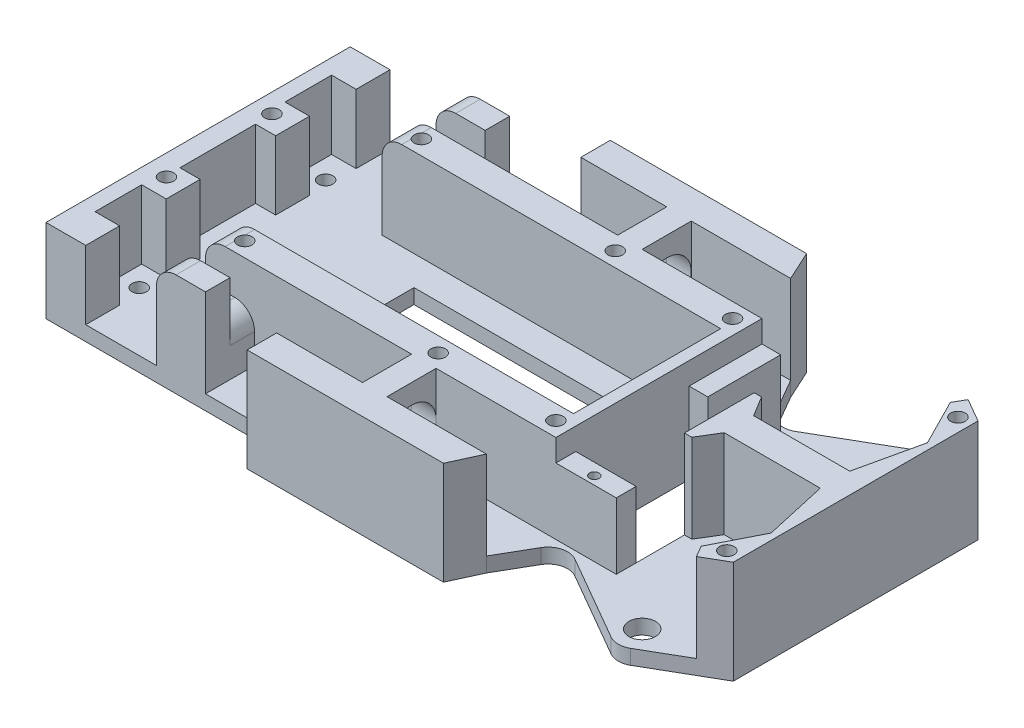
from build123d import *

# Parameters (mm, degrees)
SKETCH_1_W               = 134
SKETCH_1_H               = 62
EXTRUDE_1_DEPTH          = 3
SKETCH_2_R               = 2.7
CUT_EXTRUDE_1_DEPTH      = 4
EXTRUDE_3_DEPTH          = 3
CUT_EXTRUDE_4_DEPTH      = 4
CUT_EXTRUDE_4_DEPTH_BACK = 3
SKETCH_1_6_W             = 12.3
SKETCH_1_6_H             = 23.1
SKETCH_3_W               = 4
SKETCH_3_H               = 15.4
EXTRUDE_4_DEPTH          = 14
SKETCH_4_W               = 5
SKETCH_4_H               = 5
EXTRUDE_5_DEPTH          = 18
FILLET_1_R               = 4
EXTRUDE_6_DEPTH          = 18
SKETCH_6_W               = 12.3
SKETCH_6_H               = 4.05
SKETCH_6_W_2             = 3.8
SKETCH_6_H_2             = 14.85
EXTRUDE_7_DEPTH          = 13.5
SKETCH_7_R               = 1.48
CUT_EXTRUDE_5_DEPTH      = 5
EXTRUDE_9_DEPTH          = 18
EXTRUDE_10_DEPTH         = 18
EXTRUDE_START            = -21
SKETCH_11_W              = 5
SKETCH_11_H              = 10
EXTRUDE_11_DEPTH         = 21
SKETCH_12_R              = 5
CUT_EXTRUDE_6_DEPTH      = 6
SKETCH_13_R              = 5
CUT_EXTRUDE_7_DEPTH      = 6
SKETCH_14_R              = 0.965
CUT_EXTRUDE_8_DEPTH      = 10
SKETCH_17_R              = 1.48
CUT_EXTRUDE_10_DEPTH     = 30
SKETCH_18_R              = 1.48
CUT_EXTRUDE_11_DEPTH     = 30
SKETCH_19_R              = 1.48
CUT_EXTRUDE_12_DEPTH     = 30
SKETCH_20_W              = 5
SKETCH_20_H              = 5
CUT_EXTRUDE_13_DEPTH     = 8
SKETCH_21_R              = 1.48
CUT_EXTRUDE_14_DEPTH     = 30
SKETCH_22_R              = 1.48
CUT_EXTRUDE_15_DEPTH     = 30
SKETCH_23_R              = 1.48
CUT_EXTRUDE_16_DEPTH     = 30
SKETCH_24_W              = 50
SKETCH_24_H              = 18
CUT_EXTRUDE_17_DEPTH     = 30
FILLET_2_R               = 4
FILLET_3_R               = 4


with BuildPart() as part:
    # 草图1 → 凸台-拉伸1 (new body)
    with BuildSketch(Plane(origin=(0, 0, 0), x_dir=(1, 0, 0), z_dir=(0, 1, 0))):
        Rectangle(SKETCH_1_W, SKETCH_1_H)
    extrude(amount=EXTRUDE_1_DEPTH)

    # 草图2 → 切除-拉伸1 (cut)
    with BuildSketch(Plane(origin=(0, 3, 0), x_dir=(1, 0, 0), z_dir=(0, 1, 0))):
        with Locations(Location((51.5, 28, 0), (0, 0, 270))):
            Circle(SKETCH_2_R)
        with Locations(Location((51.5, -28, 0), (0, 0, 270))):
            Circle(SKETCH_2_R)
    extrude(amount=-CUT_EXTRUDE_1_DEPTH, mode=Mode.SUBTRACT)

    # 草图1<4> → 凸台-拉伸3 (add)
    with BuildSketch(Plane(origin=(0, 0, 0), x_dir=(1, 0, 0), z_dir=(0, 1, 0))):
        Polygon((51.75, 33.742413779), (47, 31), (56.5, 31), align=None)
        Polygon((56.5, -31), (47, -31), (51.75, -33.742413779), align=None)
    extrude(amount=EXTRUDE_3_DEPTH)

    # 草图1<6> → 切除-拉伸4 (cut, two sides: drawn at the far end of the back side and taken through both)
    with BuildSketch(Plane(origin=(0, 0, 0), x_dir=(1, 0, 0), z_dir=(0, 1, 0)).offset(-CUT_EXTRUDE_4_DEPTH_BACK)):
        with Locations((33.065250205, -5.4)):
            Rectangle(SKETCH_1_6_W, SKETCH_1_6_H)
        Polygon((47, 31), (22.751288694, 31), (28.813466521, 20.5), align=None)
        Polygon((67, 31), (56.5, 31), (67, 24.937822174), align=None)
        Polygon((28.813466521, -20.5), (22.751288694, -31), (47, -31), align=None)
        Polygon((67, -24.937822174), (56.5, -31), (67, -31), align=None)
    extrude(amount=CUT_EXTRUDE_4_DEPTH + CUT_EXTRUDE_4_DEPTH_BACK, mode=Mode.SUBTRACT)

    # 草图3 → 凸台-拉伸4 (add)
    with BuildSketch(Plane(origin=(0, 3, 0), x_dir=(1, 0, 0), z_dir=(0, 1, 0))):
        Polygon((-58.9, 31), (-67, 31), (-67, 7.7), (-63, 7.7), (-58.9, 7.7), (-58.9, 14.6), (-63.9, 14.6), (-63.9, 24.1), (-58.9, 24.1), align=None)
        Polygon((-63, -7.7), (-67, -7.7), (-67, -31), (-58.9, -31), (-58.9, -24.1), (-63.9, -24.1), (-63.9, -14.6), (-58.9, -14.6), (-58.9, -7.7), align=None)
        with Locations((-65, 0)):
            Rectangle(SKETCH_3_W, SKETCH_3_H)
    extrude(amount=EXTRUDE_4_DEPTH)

    # 草图4 → 凸台-拉伸5 (add)
    with BuildSketch(Plane(origin=(0, 3, 0), x_dir=(1, 0, 0), z_dir=(0, 1, 0))):
        Polygon((24.5, 15), (24.5, 0), (26.915250205, 0), (26.915250205, 21), (24.5, 21), align=None)
        Polygon((26.915250205, 0), (24.5, 0), (24.5, -15), (24.5, -21), (26.915250205, -21), align=None)
        Polygon((-44.5, 15), (24.5, 15), (24.5, 21), (-34.5, 21), (-39.5, 21), (-44.5, 21), align=None)
        Polygon((24.5, -21), (24.5, -15), (-44.5, -15), (-44.5, -21), (-39.5, -21), (-34.5, -21), align=None)
        with Locations((-37, 23.5)):
            Rectangle(SKETCH_4_W, SKETCH_4_H)
        with Locations((-37, -23.5)):
            Rectangle(SKETCH_4_W, SKETCH_4_H)
        Polygon((-39.5, 26), (-34.5, 26), (-34.5, 31), (-44.5, 31), (-44.5, 26), align=None)
        Polygon((-34.5, -31), (-34.5, -26), (-39.5, -26), (-44.5, -26), (-44.5, -31), align=None)
    extrude(amount=EXTRUDE_5_DEPTH)

    # 圆角1
    fillet_1_edges = [part.edges().sort_by_distance(p)[0] for p in [
        (51.75, 1.5, 33.742413779),
        (28.813466521, 1.5, 20.5),
        (28.813466521, 1.5, -20.5),
        (51.75, 1.5, -33.742413779),
    ]]
    fillet(fillet_1_edges, radius=FILLET_1_R)

    # 草图5 → 凸台-拉伸6 (add)
    with BuildSketch(Plane(origin=(0, 3, 0), x_dir=(1, 0, 0), z_dir=(0, 1, 0))):
        Polygon((43.215250205, 3), (39.215250205, 3), (39.215250205, -3), (43.215250205, -3), (67, -3), (67, 3), align=None)
        Polygon((39.215250205, 6.15), (39.215250205, 3), (43.215250205, 3), (40.715250205, 7.102951113), (39.215250205, 7.102951113), align=None)
        Polygon((43.215250205, -3), (39.215250205, -3), (39.215250205, -7.102951113), (40.715250205, -7.102951113), align=None)
    extrude(amount=EXTRUDE_6_DEPTH)

    # 草图6 → 凸台-拉伸7 (add)
    with BuildSketch(Plane(origin=(0, 3, 0), x_dir=(1, 0, 0), z_dir=(0, 1, 0))):
        with Locations((33.065250205, -18.975)):
            Rectangle(SKETCH_6_W, SKETCH_6_H)
        with Locations((28.815250205, 13.575)):
            Rectangle(SKETCH_6_W_2, SKETCH_6_H_2)
    extrude(amount=EXTRUDE_7_DEPTH)

    # 草图7 → 切除-拉伸5 (cut)
    with BuildSketch(Plane.XZ):
        with Locations(Location((-60, 19, 0), (0, 0, 270))):
            Circle(SKETCH_7_R)
        with Locations(Location((-43, 23.5, 0), (0, 0, 270))):
            Circle(SKETCH_7_R)
        with Locations(Location((-43, -23.5, 0), (0, 0, 90))):
            Circle(SKETCH_7_R)
        with Locations(Location((-60, -19, 0), (0, 0, 90))):
            Circle(SKETCH_7_R)
    extrude(amount=-CUT_EXTRUDE_5_DEPTH, mode=Mode.SUBTRACT)

    # 草图9 → 凸台-拉伸9 (add)
    with BuildSketch(Plane(origin=(0, 3, 0), x_dir=(1, 0, 0), z_dir=(0, 1, 0))):
        Polygon((67, 3), (67, 24.937822174), (62.236860279, 27.687822174), (60.906181585, 25.383019067), (65.7, 15.937822174), (62.8, 3), align=None)
    extrude(amount=EXTRUDE_9_DEPTH)

    # 草图10 → 凸台-拉伸10 (add)
    with BuildSketch(Plane(origin=(0, 3, 0), x_dir=(1, 0, 0), z_dir=(0, 1, 0))):
        Polygon((67, -3), (62.8, -3), (65.7, -15.937822174), (60.906181585, -25.383019067), (62.236860279, -27.687822174), (67, -24.937822174), align=None)
    extrude(amount=EXTRUDE_10_DEPTH)

    # 草图11 → 凸台-拉伸11 (add)
    with BuildSketch(Plane.XZ.offset(EXTRUDE_START)):
        Polygon((-2.5, -31), (-20, -31), (-20, -37), (20, -37), (20, -31), (2.5, -31), align=None)
        with Locations((0, -26)):
            Rectangle(SKETCH_11_W, SKETCH_11_H)
        Polygon((20, -31), (20, -37), (22.751288694, -31), align=None)
        Polygon((2.5, 31), (20, 31), (20, 37), (-20, 37), (-20, 31), (-2.5, 31), align=None)
        with Locations((0, 26)):
            Rectangle(SKETCH_11_W, SKETCH_11_H)
        Polygon((20, 31), (22.751288694, 31), (20, 37), align=None)
    extrude(amount=EXTRUDE_11_DEPTH)

    # 草图12 → 切除-拉伸6 (cut)
    with BuildSketch(Plane.ZY.offset(2.5)):
        with Locations((26, 12)):
            Circle(SKETCH_12_R)
    extrude(amount=-CUT_EXTRUDE_6_DEPTH, mode=Mode.SUBTRACT)

    # 草图13 → 切除-拉伸7 (cut)
    with BuildSketch(Plane.ZY.offset(2.5)):
        with Locations((-26, 12)):
            Circle(SKETCH_13_R)
    extrude(amount=-CUT_EXTRUDE_7_DEPTH, mode=Mode.SUBTRACT)

    # 草图14 → 切除-拉伸8 (cut)
    with BuildSketch(Plane(origin=(0, 16.5, 0), x_dir=(1, 0, 0), z_dir=(0, 1, 0))):
        with Locations(Location((33.065250205, -19.325, 0), (0, 0, 270))):
            Circle(SKETCH_14_R)
    extrude(amount=-CUT_EXTRUDE_8_DEPTH, mode=Mode.SUBTRACT)

    # 草图17 → 切除-拉伸10 (cut)
    with BuildSketch(Plane(origin=(0, 21, 0), x_dir=(1, 0, 0), z_dir=(0, 1, 0))):
        with Locations(Location((64.3, 23.55, 0), (0, 0, 270))):
            Circle(SKETCH_17_R)
        with Locations(Location((64.3, -23.55, 0), (0, 0, 270))):
            Circle(SKETCH_17_R)
    extrude(amount=-CUT_EXTRUDE_10_DEPTH, mode=Mode.SUBTRACT)

    # 草图18 → 切除-拉伸11 (cut)
    with BuildSketch(Plane(origin=(0, 21, 0), x_dir=(1, 0, 0), z_dir=(0, 1, 0))):
        with Locations(Location((23.915250205, 18, 0), (0, 0, 270))):
            Circle(SKETCH_18_R)
        with Locations(Location((23.915250205, -18, 0), (0, 0, 270))):
            Circle(SKETCH_18_R)
    extrude(amount=-CUT_EXTRUDE_11_DEPTH, mode=Mode.SUBTRACT)

    # 草图19 → 切除-拉伸12 (cut)
    with BuildSketch(Plane(origin=(0, 21, 0), x_dir=(1, 0, 0), z_dir=(0, 1, 0))):
        with Locations(Location((0, 18, 0), (0, 0, 270))):
            Circle(SKETCH_19_R)
        with Locations(Location((0, -18.075939793, 0), (0, 0, 270))):
            Circle(SKETCH_19_R)
    extrude(amount=-CUT_EXTRUDE_12_DEPTH, mode=Mode.SUBTRACT)

    # 草图20 → 切除-拉伸13 (cut)
    with BuildSketch(Plane(origin=(0, 21, 0), x_dir=(1, 0, 0), z_dir=(0, 1, 0))):
        with Locations((-37, 23.5)):
            Rectangle(SKETCH_20_W, SKETCH_20_H)
        with Locations((-37, -23.5)):
            Rectangle(SKETCH_20_W, SKETCH_20_H)
    extrude(amount=-CUT_EXTRUDE_13_DEPTH, mode=Mode.SUBTRACT)

    # 草图21 → 切除-拉伸14 (cut)
    with BuildSketch(Plane(origin=(0, 21, 0), x_dir=(1, 0, 0), z_dir=(0, 1, 0))):
        with Locations(Location((-39.5, 18, 0), (0, 0, 270))):
            Circle(SKETCH_21_R)
        with Locations(Location((-39.5, -18, 0), (0, 0, 270))):
            Circle(SKETCH_21_R)
    extrude(amount=-CUT_EXTRUDE_14_DEPTH, mode=Mode.SUBTRACT)

    # 草图22 → 切除-拉伸15 (cut)
    with BuildSketch(Plane(origin=(0, 17, 0), x_dir=(1, 0, 0), z_dir=(0, 1, 0))):
        with Locations(Location((-63.15, 11.2, 0), (0, 0, 270))):
            Circle(SKETCH_22_R)
    extrude(amount=-CUT_EXTRUDE_15_DEPTH, mode=Mode.SUBTRACT)

    # 草图23 → 切除-拉伸16 (cut)
    with BuildSketch(Plane(origin=(0, 17, 0), x_dir=(1, 0, 0), z_dir=(0, 1, 0))):
        with Locations(Location((-62.75, -10.701666204, 0), (0, 0, 270))):
            Circle(SKETCH_23_R)
    extrude(amount=-CUT_EXTRUDE_16_DEPTH, mode=Mode.SUBTRACT)

    # 草图24 → 切除-拉伸17 (cut)
    with BuildSketch(Plane(origin=(0, 3, 0), x_dir=(1, 0, 0), z_dir=(0, 1, 0))):
        with Locations((-7, 0)):
            Rectangle(SKETCH_24_W, SKETCH_24_H)
    extrude(amount=-CUT_EXTRUDE_17_DEPTH, mode=Mode.SUBTRACT)

    # 圆角2
    # the kernel refuses this fillet: 4 mm, written as the material it takes off along each edge
    with BuildSketch(Plane(origin=(-44.5, 21, 5), x_dir=(1, 0, 0), z_dir=(0, 0, 1)), Plane(origin=(-44.5, 21, -31), x_dir=(1, 0, 0), z_dir=(0, 0, 1))) as fillet_2_piece_1:
        with BuildLine():
            CenterArc((FILLET_2_R, -FILLET_2_R), FILLET_2_R, 90, 90)
            Line((0, -FILLET_2_R), (0, 0))
            Line((0, 0), (FILLET_2_R, 0))
        make_face()
    extrude(amount=26, mode=Mode.SUBTRACT)
    with BuildSketch(Plane(origin=(-44.5, 21, -41), x_dir=(1, 0, 0), z_dir=(0, 0, 1))) as fillet_2_piece_2:
        with BuildLine():
            CenterArc((FILLET_2_R, -FILLET_2_R), FILLET_2_R, 90, 90)
            Line((0, -FILLET_2_R), (0, 0))
            Line((0, 0), (FILLET_2_R, 0))
        make_face()
    extrude(amount=25, mode=Mode.SUBTRACT)
    with BuildSketch(Plane(origin=(-44.5, 21, 16), x_dir=(0, -1, 0), z_dir=(0, 0, 1))) as fillet_2_piece_3:
        with BuildLine():
            CenterArc((FILLET_2_R, FILLET_2_R), FILLET_2_R, 180, 90)
            Line((0, FILLET_2_R), (0, 0))
            Line((0, 0), (FILLET_2_R, 0))
        make_face()
    extrude(amount=25, mode=Mode.SUBTRACT)

    # 圆角3
    fillet_3_edges = [part.edges().sort_by_distance(p)[0] for p in [
        (-34.5, 13, -23.5),
        (-34.5, 13, 23.5),
    ]]
    fillet(fillet_3_edges, radius=FILLET_3_R)


solid = part.part
